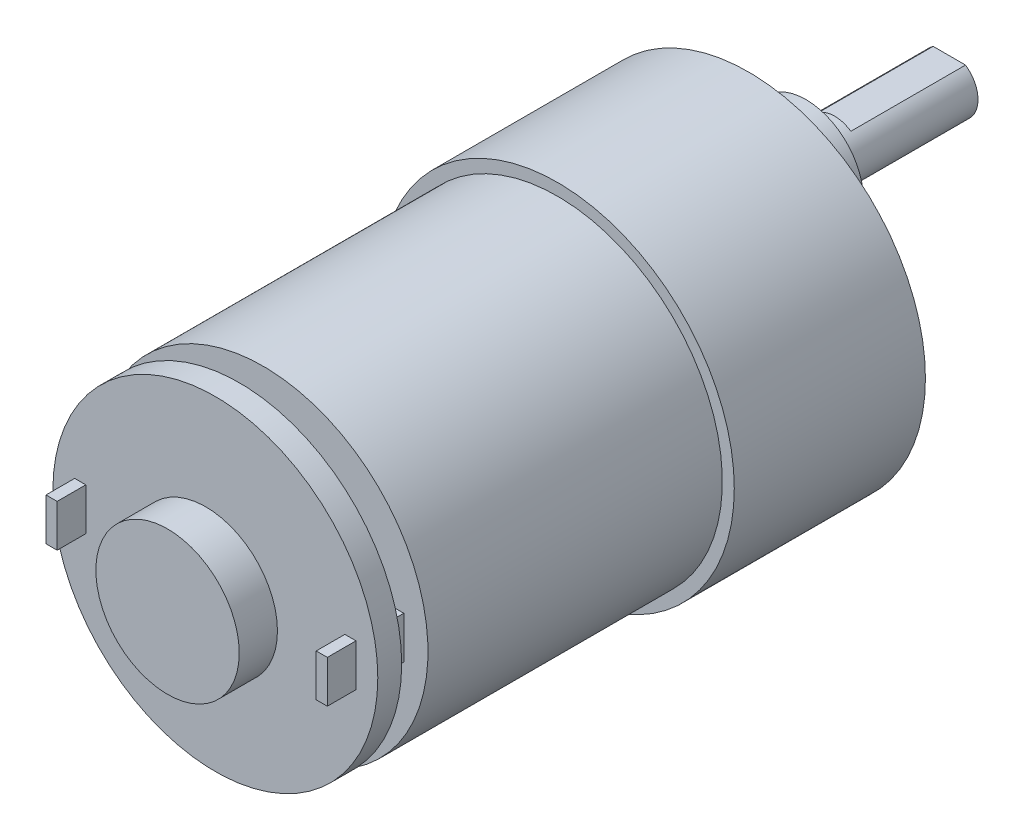
from build123d import *

# Parameters (mm, degrees)
SKETCH1_R            = 18.5
BOSS_EXTRUDE2_DEPTH  = 20
SKETCH2_R            = 17.25
BOSS_EXTRUDE3_DEPTH  = 30.8
SKETCH3_R            = 1.5
BOSS_EXTRUDE4_DEPTH  = 5
SKETCH5_W            = 1.164728471
SKETCH5_H            = 4.428190706
BOSS_EXTRUDE9_DEPTH  = 8
SKETCH6_R            = 6
BOSS_EXTRUDE12_DEPTH = 6
SKETCH9_R            = 3
BOSS_EXTRUDE13_DEPTH = 15
SKETCH10_W           = 6.033853608
SKETCH10_H           = 1
CUT_EXTRUDE1_DEPTH   = 12
SKETCH11_R           = 1.5
CUT_EXTRUDE4_DEPTH   = 5
CUT_EXTRUDE5_DEPTH   = 0.5
SKETCH13_R           = 17
BOSS_EXTRUDE14_DEPTH = 2.5
SKETCH15_R           = 1.489724088
BOSS_EXTRUDE16_DEPTH = 1
SKETCH16_R           = 7.5
BOSS_EXTRUDE17_DEPTH = 4


with BuildPart() as part:
    # Sketch1 → Boss-Extrude2 (new body)
    with BuildSketch(Plane.XY):
        Circle(SKETCH1_R)
    extrude(amount=-BOSS_EXTRUDE2_DEPTH)

    # Sketch2 → Boss-Extrude3 (add)
    with BuildSketch(Plane.XY):
        Circle(SKETCH2_R)
    extrude(amount=BOSS_EXTRUDE3_DEPTH)

    # Sketch3 → Boss-Extrude4 (add)
    with BuildSketch(Plane.XY.offset(30.8)):
        Circle(SKETCH3_R)
    extrude(amount=BOSS_EXTRUDE4_DEPTH)

    # Sketch5 → Boss-Extrude9 (add)
    with BuildSketch(Plane.XY.offset(30.8)):
        with Locations((14.135311547, 0)):
            Rectangle(SKETCH5_W, SKETCH5_H)
        with Locations((-14.135311547, 0)):
            Rectangle(SKETCH5_W, SKETCH5_H)
    extrude(amount=BOSS_EXTRUDE9_DEPTH)

    # Sketch6 → Boss-Extrude12 (add)
    with BuildSketch(Plane(origin=(0, 0, -20), x_dir=(-1, 0, 0), z_dir=(0, 0, -1))):
        with Locations((0, 7)):
            Circle(SKETCH6_R)
    extrude(amount=BOSS_EXTRUDE12_DEPTH)

    # Sketch9 → Boss-Extrude13 (add)
    with BuildSketch(Plane(origin=(0, 0, -26), x_dir=(-1, 0, 0), z_dir=(0, 0, -1))):
        with Locations((0, 7)):
            Circle(SKETCH9_R)
    extrude(amount=BOSS_EXTRUDE13_DEPTH)

    # Sketch10 → Cut-Extrude1 (cut)
    with BuildSketch(Plane(origin=(0, 0, -41), x_dir=(-1, 0, 0), z_dir=(0, 0, -1))):
        with Locations((0, 9.974859546)):
            Rectangle(SKETCH10_W, SKETCH10_H)
    extrude(amount=-CUT_EXTRUDE1_DEPTH, mode=Mode.SUBTRACT)

    # Sketch11 → Cut-Extrude4 (cut)
    with BuildSketch(Plane(origin=(0, 0, -20), x_dir=(-1, 0, 0), z_dir=(0, 0, -1))):
        with Locations((-13.423393759, 7.75)):
            Circle(SKETCH11_R)
        with Locations((13.423393759, 7.75)):
            Circle(SKETCH11_R)
        with Locations((0, -15.5)):
            Circle(SKETCH11_R)
        with Locations((-7.75, 13.423393759)):
            Circle(SKETCH11_R)
        with Locations((7.75, 13.423393759)):
            Circle(SKETCH11_R)
        with Locations((15.5, 0)):
            Circle(SKETCH11_R)
        with Locations((7.75, -13.423393759)):
            Circle(SKETCH11_R)
        with Locations((-7.75, -13.423393759)):
            Circle(SKETCH11_R)
        with Locations((-15.5, 0)):
            Circle(SKETCH11_R)
    extrude(amount=-CUT_EXTRUDE4_DEPTH, mode=Mode.SUBTRACT)

    # Sketch12 → Cut-Extrude5 (cut)
    with BuildSketch(Plane(origin=(0, 0, -20), x_dir=(-1, 0, 0), z_dir=(0, 0, -1))):
        with BuildLine():
            ThreePointArc((-9.996975987, 5.233316288), (-0.033546899, -11.826522584), (9.929882188, 5.233316288))
            ThreePointArc((9.929882188, 5.233316288), (-0.033546899, -1.867556413), (-9.996975987, 5.233316288))
        make_face()
    extrude(amount=-CUT_EXTRUDE5_DEPTH, mode=Mode.SUBTRACT)

    # Sketch13 → Boss-Extrude14 (add)
    with BuildSketch(Plane.XY.offset(35.8)):
        Circle(SKETCH13_R)
    extrude(amount=-BOSS_EXTRUDE14_DEPTH)

    # Sketch15 → Boss-Extrude16 (add)
    with BuildSketch(Plane.XY.offset(35.8)):
        Circle(SKETCH15_R)
    extrude(amount=BOSS_EXTRUDE16_DEPTH)

    # Sketch16 → Boss-Extrude17 (add)
    with BuildSketch(Plane.XY.offset(36.8)):
        Circle(SKETCH16_R)
    extrude(amount=BOSS_EXTRUDE17_DEPTH)


solid = part.part
